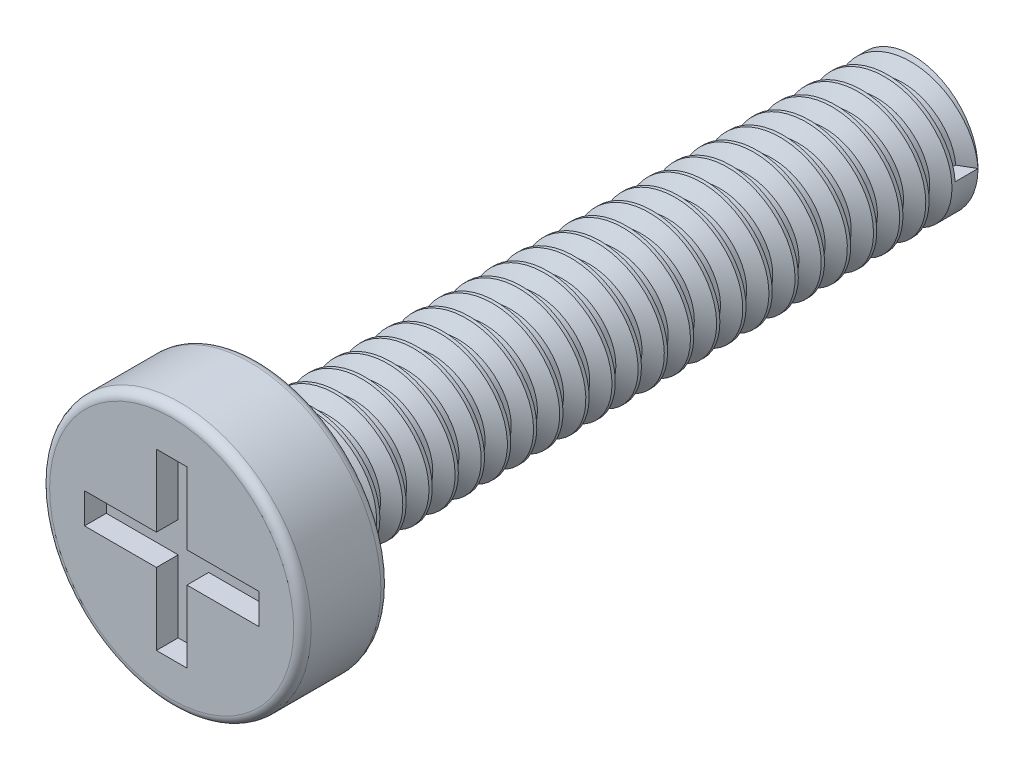
from build123d import *

# Parameters (mm, degrees)
SKETCH1_R           = 1.5
BOSS_EXTRUDE1_DEPTH = 15
SKETCH2_R           = 3
BOSS_EXTRUDE2_DEPTH = 2
SKETCH7_W           = 0.7
SKETCH7_H           = 1.65
SKETCH7_W_2         = 1.65
SKETCH7_H_2         = 0.7
CUT_EXTRUDE1_DEPTH  = 0.5
FILLET1_R           = 0.2
THREAD1_PITCH       = 0.6


with BuildPart() as part:
    # Sketch1 → Boss-Extrude1 (new body)
    with BuildSketch(Plane.XY):
        Circle(SKETCH1_R)
    extrude(amount=BOSS_EXTRUDE1_DEPTH)

    # Sketch2 → Boss-Extrude2 (add)
    with BuildSketch(Plane.XY.offset(15)):
        Circle(SKETCH2_R)
    extrude(amount=BOSS_EXTRUDE2_DEPTH)

    # Sketch7 → Cut-Extrude1 (cut)
    with BuildSketch(Plane.XY.offset(17)):
        with Locations((0, 1.175)):
            Rectangle(SKETCH7_W, SKETCH7_H)
        with Locations((1.175, 0)):
            Rectangle(SKETCH7_W_2, SKETCH7_H_2)
        with Locations((0, -1.175)):
            Rectangle(SKETCH7_W, SKETCH7_H)
        with Locations((-1.175, 0)):
            Rectangle(SKETCH7_W_2, SKETCH7_H_2)
        Rectangle(SKETCH7_W, SKETCH7_H_2)
    extrude(amount=-CUT_EXTRUDE1_DEPTH, mode=Mode.SUBTRACT)

    # Fillet1
    fillet1_edges = [part.edges().sort_by_distance(p)[0] for p in [
        (-3, 0, 15),
        (-3, 0, 17),
    ]]
    fillet(fillet1_edges, radius=FILLET1_R)

    # Thread1: the profile of Thread Profile1 profile screwed along a right-hand helix of 25 turns, 6 arcs to a turn; built about Z, then put on its axis
    thread1_z = Axis((0, 0, 0), (0, 0, 1))
    thread1_corners = [(1.5003, 0, -0.000173205), (1.5003, 0, 0.525173203), (1.175240475, 0, 0.337499999), (1.175240475, 0, 0.187499999)]
    with BuildLine(mode=Mode.PRIVATE) as thread1_profile:
        Line(thread1_corners[0], thread1_corners[1])
        Line(thread1_corners[1], thread1_corners[2])
        Line(thread1_corners[2], thread1_corners[3])
        Line(thread1_corners[3], thread1_corners[0])
    thread1_cap = Face(thread1_profile.wire())
    thread1_turn_angles = [0, 30, 60, 90, 120, 150, 180, 210, 240, 270, 300, 330, 360]
    thread1_turn_weights = [1, 0.8660254037844387, 1, 0.8660254037844387, 1, 0.8660254037844387, 1, 0.8660254037844387, 1, 0.8660254037844387, 1, 0.8660254037844387, 1]
    thread1_turn_rails = [Edge.make_bspline([Vector(p[0], p[1], 0).rotate(thread1_z, thread1_turn_angles[k]) / thread1_turn_weights[k] + Vector(0, 0, p[2] + THREAD1_PITCH * thread1_turn_angles[k] / 360) for k in range(13)], [0, 0, 0, 1, 1, 2, 2, 3, 3, 4, 4, 5, 5, 6, 6, 6], 2, thread1_turn_weights) for p in thread1_corners]
    thread1_turn_sides = [Face.make_surface_from_curves(thread1_turn_rails[p[0]], thread1_turn_rails[p[1]]) for p in [(0, 1), (1, 2), (2, 3), (3, 0)]]
    thread1 = Plane(origin=(0, 0, 0), x_dir=(1, 0, 0), z_dir=(0, 0, 1)) * Solid(Shell([*[p.moved(Location((0, 0, THREAD1_PITCH * i))) for i in range(25) for p in thread1_turn_sides], thread1_cap, thread1_cap.rotate(thread1_z, 9000).moved(Location((0, 0, THREAD1_PITCH * 9000 / 360)))]))
    add(thread1, mode=Mode.SUBTRACT)


solid = part.part
